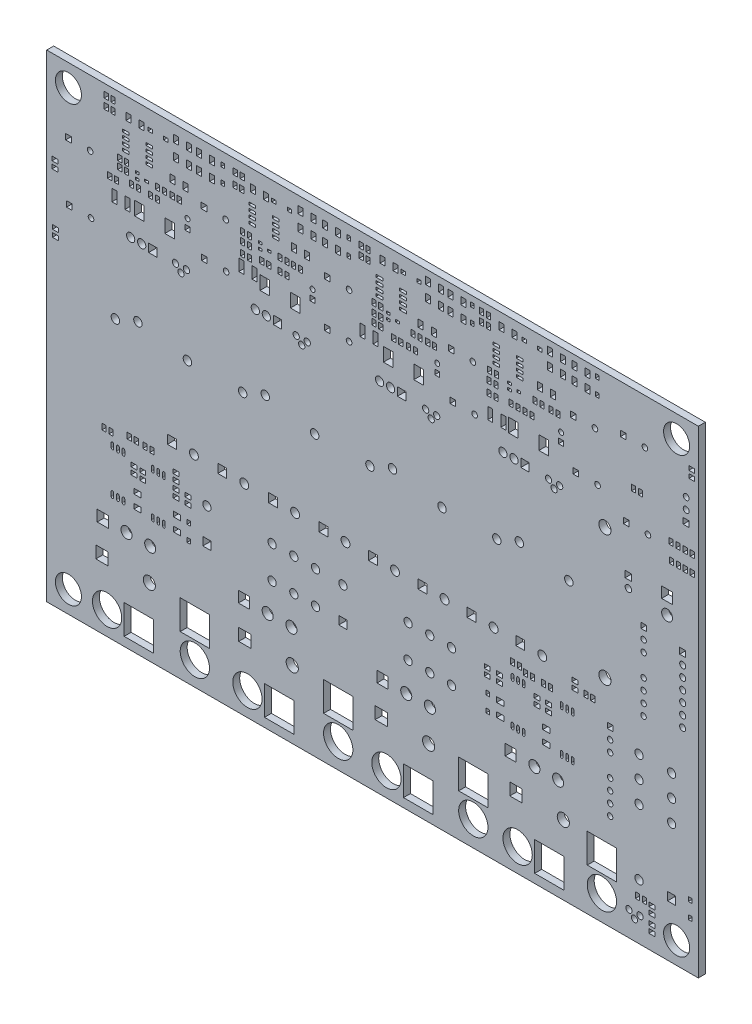
from build123d import *

# Parameters (mm, degrees)
MODEL_W            = 150
MODEL_H            = 110
MODEL_R            = 0.675
MODEL_R_2          = 0.75
MODEL_R_3          = 0.7
MODEL_R_4          = 1.25
MODEL_R_5          = 0.625
MODEL_R_6          = 1.4
MODEL_R_7          = 1.275
MODEL_R_8          = 3.375
MODEL_R_9          = 0.65
MODEL_R_10         = 0.725
MODEL_R_11         = 0.575
MODEL_R_12         = 0.95
MODEL_R_13         = 1.025
MODEL_R_14         = 0.975
MODEL_R_15         = 3
MODEL_W_2          = 2.2
MODEL_H_2          = 3.15
MODEL_W_3          = 1.55
MODEL_H_3          = 0.6
MODEL_W_4          = 1.35
MODEL_H_4          = 1.35
MODEL_W_5          = 0.95
MODEL_W_6          = 1.5
MODEL_H_5          = 1.5
MODEL_W_7          = 1.4
MODEL_H_6          = 1.4
MODEL_W_8          = 2.5
MODEL_H_7          = 2.5
MODEL_W_9          = 1.25
MODEL_H_8          = 1.25
MODEL_W_10         = 2.8
MODEL_H_9          = 2.8
MODEL_W_11         = 2.55
MODEL_H_10         = 2.55
MODEL_W_12         = 6.75
MODEL_H_11         = 6.75
MODEL_W_13         = 1.3
MODEL_H_12         = 1.3
MODEL_W_14         = 1.65
MODEL_H_13         = 1.15
MODEL_W_15         = 1.15
MODEL_H_14         = 1.65
MODEL_H_15         = 2.7
MODEL_H_16         = 0.95
MODEL_W_16         = 0.85
MODEL_H_17         = 0.55
MODEL_W_17         = 0.8
MODEL_H_18         = 1
MODEL_W_18         = 1
MODEL_H_19         = 0.8
MODEL_W_19         = 1.9
MODEL_H_20         = 1.9
MODEL_W_20         = 2.05
MODEL_H_21         = 2.05
BOSS_EXTRU_1_DEPTH = 1.6


with BuildPart() as part:
    # Model → Boss.-Extru.1 (new body)
    with BuildSketch(Plane.XY):
        with Locations((75, -55)):
            Rectangle(MODEL_W, MODEL_H)
        with Locations((147.2, -18.06)):
            Circle(MODEL_R, mode=Mode.SUBTRACT)
        with Locations((147.2, -15.52)):
            Circle(MODEL_R, mode=Mode.SUBTRACT)
        with Locations((133.9, -40.4)):
            Circle(MODEL_R_2, mode=Mode.SUBTRACT)
        with Locations((146.4, -49.4)):
            Circle(MODEL_R_3, mode=Mode.SUBTRACT)
        with Locations((146.4, -51.9)):
            Circle(MODEL_R_3, mode=Mode.SUBTRACT)
        with Locations((146.4, -54.4)):
            Circle(MODEL_R_3, mode=Mode.SUBTRACT)
        with Locations((146.4, -56.9)):
            Circle(MODEL_R_3, mode=Mode.SUBTRACT)
        with Locations((146.4, -59.4)):
            Circle(MODEL_R_3, mode=Mode.SUBTRACT)
        with Locations((146.4, -61.9)):
            Circle(MODEL_R_3, mode=Mode.SUBTRACT)
        with Locations((142.8, -41.26)):
            Circle(MODEL_R_4, mode=Mode.SUBTRACT)
        with Locations((129.7, -72.64)):
            Circle(MODEL_R_5, mode=Mode.SUBTRACT)
        with Locations((129.7, -75.18)):
            Circle(MODEL_R_5, mode=Mode.SUBTRACT)
        with Locations((129.7, -80.26)):
            Circle(MODEL_R_5, mode=Mode.SUBTRACT)
        with Locations((129.7, -82.8)):
            Circle(MODEL_R_5, mode=Mode.SUBTRACT)
        with Locations((129.7, -85.34)):
            Circle(MODEL_R_5, mode=Mode.SUBTRACT)
        with Locations((129.7, -87.88)):
            Circle(MODEL_R_5, mode=Mode.SUBTRACT)
        with Locations((137.4, -48.84)):
            Circle(MODEL_R_5, mode=Mode.SUBTRACT)
        with Locations((137.4, -51.38)):
            Circle(MODEL_R_5, mode=Mode.SUBTRACT)
        with Locations((137.4, -56.46)):
            Circle(MODEL_R_5, mode=Mode.SUBTRACT)
        with Locations((137.4, -59)):
            Circle(MODEL_R_5, mode=Mode.SUBTRACT)
        with Locations((137.4, -61.54)):
            Circle(MODEL_R_5, mode=Mode.SUBTRACT)
        with Locations((137.4, -64.08)):
            Circle(MODEL_R_5, mode=Mode.SUBTRACT)
        with Locations((118.92, -94)):
            Circle(MODEL_R_6, mode=Mode.SUBTRACT)
        with Locations((87.92, -94.3)):
            Circle(MODEL_R_6, mode=Mode.SUBTRACT)
        with Locations((23.62, -94.4)):
            Circle(MODEL_R_6, mode=Mode.SUBTRACT)
        with Locations((56.52, -94.4)):
            Circle(MODEL_R_6, mode=Mode.SUBTRACT)
        with Locations((112.26, -86.7)):
            Circle(MODEL_R_7, mode=Mode.SUBTRACT)
        with Locations((117.72, -86.7)):
            Circle(MODEL_R_7, mode=Mode.SUBTRACT)
        with Locations((82.76, -86.9)):
            Circle(MODEL_R_7, mode=Mode.SUBTRACT)
        with Locations((88.22, -86.9)):
            Circle(MODEL_R_7, mode=Mode.SUBTRACT)
        with Locations((50.86, -86.9)):
            Circle(MODEL_R_7, mode=Mode.SUBTRACT)
        with Locations((56.32, -86.9)):
            Circle(MODEL_R_7, mode=Mode.SUBTRACT)
        with Locations((18.36, -87)):
            Circle(MODEL_R_7, mode=Mode.SUBTRACT)
        with Locations((23.82, -87)):
            Circle(MODEL_R_7, mode=Mode.SUBTRACT)
        with Locations((127.8, -104.2)):
            Circle(MODEL_R_8, mode=Mode.SUBTRACT)
        with Locations((108.4, -104.6)):
            Circle(MODEL_R_8, mode=Mode.SUBTRACT)
        with Locations((98.2, -104.2)):
            Circle(MODEL_R_8, mode=Mode.SUBTRACT)
        with Locations((78.2, -104.6)):
            Circle(MODEL_R_8, mode=Mode.SUBTRACT)
        with Locations((46.2, -104.6)):
            Circle(MODEL_R_8, mode=Mode.SUBTRACT)
        with Locations((67.1, -104.3)):
            Circle(MODEL_R_8, mode=Mode.SUBTRACT)
        with Locations((13.9, -104.6)):
            Circle(MODEL_R_8, mode=Mode.SUBTRACT)
        with Locations((34.1, -104.5)):
            Circle(MODEL_R_8, mode=Mode.SUBTRACT)
        with Locations((126.2, -12.3)):
            Circle(MODEL_R_9, mode=Mode.SUBTRACT)
        with Locations((126.8, -23.3)):
            Circle(MODEL_R_9, mode=Mode.SUBTRACT)
        with Locations((98.1, -13.1)):
            Circle(MODEL_R_9, mode=Mode.SUBTRACT)
        with Locations((98.5, -23.4)):
            Circle(MODEL_R_9, mode=Mode.SUBTRACT)
        with Locations((69.6, -13)):
            Circle(MODEL_R_9, mode=Mode.SUBTRACT)
        with Locations((69.6, -23.3)):
            Circle(MODEL_R_9, mode=Mode.SUBTRACT)
        with Locations((41.2, -13.2)):
            Circle(MODEL_R_9, mode=Mode.SUBTRACT)
        with Locations((41.3, -23.5)):
            Circle(MODEL_R_9, mode=Mode.SUBTRACT)
        with Locations((134.03, -104.3)):
            Circle(MODEL_R_10, mode=Mode.SUBTRACT)
        with Locations((135.3, -105.57)):
            Circle(MODEL_R_10, mode=Mode.SUBTRACT)
        with Locations((136.57, -104.3)):
            Circle(MODEL_R_10, mode=Mode.SUBTRACT)
        with Locations((115.53, -27.8)):
            Circle(MODEL_R_10, mode=Mode.SUBTRACT)
        with Locations((116.8, -29.07)):
            Circle(MODEL_R_10, mode=Mode.SUBTRACT)
        with Locations((118.07, -27.8)):
            Circle(MODEL_R_10, mode=Mode.SUBTRACT)
        with Locations((87.23, -28)):
            Circle(MODEL_R_10, mode=Mode.SUBTRACT)
        with Locations((88.5, -29.27)):
            Circle(MODEL_R_10, mode=Mode.SUBTRACT)
        with Locations((89.77, -28)):
            Circle(MODEL_R_10, mode=Mode.SUBTRACT)
        with Locations((57.43, -28.2)):
            Circle(MODEL_R_10, mode=Mode.SUBTRACT)
        with Locations((58.7, -29.47)):
            Circle(MODEL_R_10, mode=Mode.SUBTRACT)
        with Locations((59.97, -28.2)):
            Circle(MODEL_R_10, mode=Mode.SUBTRACT)
        with Locations((29.63, -27.7)):
            Circle(MODEL_R_10, mode=Mode.SUBTRACT)
        with Locations((30.9, -28.97)):
            Circle(MODEL_R_10, mode=Mode.SUBTRACT)
        with Locations((32.17, -27.7)):
            Circle(MODEL_R_10, mode=Mode.SUBTRACT)
        with Locations((138.4, -27.4)):
            Circle(MODEL_R_9, mode=Mode.SUBTRACT)
        with Locations((137.7, -10.4)):
            Circle(MODEL_R_9, mode=Mode.SUBTRACT)
        with Locations((10.2, -28.4)):
            Circle(MODEL_R_9, mode=Mode.SUBTRACT)
        with Locations((10, -15.1)):
            Circle(MODEL_R_9, mode=Mode.SUBTRACT)
        with Locations((118.4, -17)):
            Circle(MODEL_R_11, mode=Mode.SUBTRACT)
        with Locations((89.9, -17.5)):
            Circle(MODEL_R_11, mode=Mode.SUBTRACT)
        with Locations((61.2, -17.1)):
            Circle(MODEL_R_11, mode=Mode.SUBTRACT)
        with Locations((32.4, -17.4)):
            Circle(MODEL_R_11, mode=Mode.SUBTRACT)
        with Locations((143.85, -82.22)):
            Circle(MODEL_R_12, mode=Mode.SUBTRACT)
        with Locations((143.85, -77.22)):
            Circle(MODEL_R_12, mode=Mode.SUBTRACT)
        with Locations((143.85, -72.22)):
            Circle(MODEL_R_12, mode=Mode.SUBTRACT)
        with Locations((136.35, -72.22)):
            Circle(MODEL_R_12, mode=Mode.SUBTRACT)
        with Locations((136.35, -77.22)):
            Circle(MODEL_R_12, mode=Mode.SUBTRACT)
        with Locations((136.35, -82.22)):
            Circle(MODEL_R_12, mode=Mode.SUBTRACT)
        with Locations((136.35, -97.22)):
            Circle(MODEL_R_12, mode=Mode.SUBTRACT)
        with Locations((83.18, -80.05)):
            Circle(MODEL_R_12, mode=Mode.SUBTRACT)
        with Locations((88.18, -80.05)):
            Circle(MODEL_R_12, mode=Mode.SUBTRACT)
        with Locations((93.18, -80.05)):
            Circle(MODEL_R_12, mode=Mode.SUBTRACT)
        with Locations((93.18, -72.55)):
            Circle(MODEL_R_12, mode=Mode.SUBTRACT)
        with Locations((88.18, -72.55)):
            Circle(MODEL_R_12, mode=Mode.SUBTRACT)
        with Locations((83.18, -72.55)):
            Circle(MODEL_R_12, mode=Mode.SUBTRACT)
        with Locations((68.18, -72.55)):
            Circle(MODEL_R_12, mode=Mode.SUBTRACT)
        with Locations((51.88, -79.95)):
            Circle(MODEL_R_12, mode=Mode.SUBTRACT)
        with Locations((56.88, -79.95)):
            Circle(MODEL_R_12, mode=Mode.SUBTRACT)
        with Locations((61.88, -79.95)):
            Circle(MODEL_R_12, mode=Mode.SUBTRACT)
        with Locations((61.88, -72.45)):
            Circle(MODEL_R_12, mode=Mode.SUBTRACT)
        with Locations((56.88, -72.45)):
            Circle(MODEL_R_12, mode=Mode.SUBTRACT)
        with Locations((51.88, -72.45)):
            Circle(MODEL_R_12, mode=Mode.SUBTRACT)
        with Locations((36.88, -72.45)):
            Circle(MODEL_R_12, mode=Mode.SUBTRACT)
        with Locations((114.08, -63.7)):
            Circle(MODEL_R_13, mode=Mode.SUBTRACT)
        with Locations((91.58, -63.7)):
            Circle(MODEL_R_13, mode=Mode.SUBTRACT)
        with Locations((102.88, -63.7)):
            Circle(MODEL_R_13, mode=Mode.SUBTRACT)
        with Locations((80.18, -63.7)):
            Circle(MODEL_R_13, mode=Mode.SUBTRACT)
        with Locations((68.78, -63.7)):
            Circle(MODEL_R_13, mode=Mode.SUBTRACT)
        with Locations((57.18, -63.7)):
            Circle(MODEL_R_13, mode=Mode.SUBTRACT)
        with Locations((45.48, -63.7)):
            Circle(MODEL_R_13, mode=Mode.SUBTRACT)
        with Locations((33.88, -63.7)):
            Circle(MODEL_R_13, mode=Mode.SUBTRACT)
        with Locations((21.86, -27.7)):
            Circle(MODEL_R_12, mode=Mode.SUBTRACT)
        with Locations((19.32, -27.7)):
            Circle(MODEL_R_12, mode=Mode.SUBTRACT)
        with Locations((50.56, -27.7)):
            Circle(MODEL_R_12, mode=Mode.SUBTRACT)
        with Locations((48.02, -27.7)):
            Circle(MODEL_R_12, mode=Mode.SUBTRACT)
        with Locations((79.16, -27.7)):
            Circle(MODEL_R_12, mode=Mode.SUBTRACT)
        with Locations((76.62, -27.7)):
            Circle(MODEL_R_12, mode=Mode.SUBTRACT)
        with Locations((107.56, -27.7)):
            Circle(MODEL_R_12, mode=Mode.SUBTRACT)
        with Locations((105.02, -27.7)):
            Circle(MODEL_R_12, mode=Mode.SUBTRACT)
        with Locations((103.606, -45.7)):
            Circle(MODEL_R_14, mode=Mode.SUBTRACT)
        with Locations((120.19, -45.7)):
            Circle(MODEL_R_14, mode=Mode.SUBTRACT)
        with Locations((108.8, -43.681)):
            Circle(MODEL_R_14, mode=Mode.SUBTRACT)
        with Locations((74.406, -45.7)):
            Circle(MODEL_R_14, mode=Mode.SUBTRACT)
        with Locations((90.99, -45.7)):
            Circle(MODEL_R_14, mode=Mode.SUBTRACT)
        with Locations((79.6, -43.681)):
            Circle(MODEL_R_14, mode=Mode.SUBTRACT)
        with Locations((45.106, -45.7)):
            Circle(MODEL_R_14, mode=Mode.SUBTRACT)
        with Locations((61.69, -45.7)):
            Circle(MODEL_R_14, mode=Mode.SUBTRACT)
        with Locations((50.3, -43.681)):
            Circle(MODEL_R_14, mode=Mode.SUBTRACT)
        with Locations((15.806, -45.7)):
            Circle(MODEL_R_14, mode=Mode.SUBTRACT)
        with Locations((32.39, -45.7)):
            Circle(MODEL_R_14, mode=Mode.SUBTRACT)
        with Locations((21, -43.681)):
            Circle(MODEL_R_14, mode=Mode.SUBTRACT)
        with Locations((128.5, -60.9)):
            Circle(MODEL_R_6, mode=Mode.SUBTRACT)
        with Locations((128.5, -30.9)):
            Circle(MODEL_R_6, mode=Mode.SUBTRACT)
        with Locations((5, -5)):
            Circle(MODEL_R_15, mode=Mode.SUBTRACT)
        with Locations((145, -5)):
            Circle(MODEL_R_15, mode=Mode.SUBTRACT)
        with Locations((145, -105)):
            Circle(MODEL_R_15, mode=Mode.SUBTRACT)
        with Locations((5, -105)):
            Circle(MODEL_R_15, mode=Mode.SUBTRACT)
        with Locations((114.4, -21.6)):
            Rectangle(MODEL_W_2, MODEL_H_2, mode=Mode.SUBTRACT)
        with Locations((107.4, -21.6)):
            Rectangle(MODEL_W_2, MODEL_H_2, mode=Mode.SUBTRACT)
        with Locations((85.6, -21.9)):
            Rectangle(MODEL_W_2, MODEL_H_2, mode=Mode.SUBTRACT)
        with Locations((78.6, -21.9)):
            Rectangle(MODEL_W_2, MODEL_H_2, mode=Mode.SUBTRACT)
        with Locations((57.2, -21.8)):
            Rectangle(MODEL_W_2, MODEL_H_2, mode=Mode.SUBTRACT)
        with Locations((50.2, -21.8)):
            Rectangle(MODEL_W_2, MODEL_H_2, mode=Mode.SUBTRACT)
        with Locations((28.3, -21.4)):
            Rectangle(MODEL_W_2, MODEL_H_2, mode=Mode.SUBTRACT)
        with Locations((21.3, -21.4)):
            Rectangle(MODEL_W_2, MODEL_H_2, mode=Mode.SUBTRACT)
        with Locations((18.2, -7.295)):
            Rectangle(MODEL_W_3, MODEL_H_3, mode=Mode.SUBTRACT)
        with Locations((18.2, -8.565)):
            Rectangle(MODEL_W_3, MODEL_H_3, mode=Mode.SUBTRACT)
        with Locations((18.2, -9.835)):
            Rectangle(MODEL_W_3, MODEL_H_3, mode=Mode.SUBTRACT)
        with Locations((18.2, -11.105)):
            Rectangle(MODEL_W_3, MODEL_H_3, mode=Mode.SUBTRACT)
        with Locations((23.6, -11.105)):
            Rectangle(MODEL_W_3, MODEL_H_3, mode=Mode.SUBTRACT)
        with Locations((23.6, -9.835)):
            Rectangle(MODEL_W_3, MODEL_H_3, mode=Mode.SUBTRACT)
        with Locations((23.6, -8.565)):
            Rectangle(MODEL_W_3, MODEL_H_3, mode=Mode.SUBTRACT)
        with Locations((23.6, -7.295)):
            Rectangle(MODEL_W_3, MODEL_H_3, mode=Mode.SUBTRACT)
        with Locations((103.5, -7.095)):
            Rectangle(MODEL_W_3, MODEL_H_3, mode=Mode.SUBTRACT)
        with Locations((103.5, -8.365)):
            Rectangle(MODEL_W_3, MODEL_H_3, mode=Mode.SUBTRACT)
        with Locations((103.5, -9.635)):
            Rectangle(MODEL_W_3, MODEL_H_3, mode=Mode.SUBTRACT)
        with Locations((103.5, -10.905)):
            Rectangle(MODEL_W_3, MODEL_H_3, mode=Mode.SUBTRACT)
        with Locations((108.9, -10.905)):
            Rectangle(MODEL_W_3, MODEL_H_3, mode=Mode.SUBTRACT)
        with Locations((108.9, -9.635)):
            Rectangle(MODEL_W_3, MODEL_H_3, mode=Mode.SUBTRACT)
        with Locations((108.9, -8.365)):
            Rectangle(MODEL_W_3, MODEL_H_3, mode=Mode.SUBTRACT)
        with Locations((108.9, -7.095)):
            Rectangle(MODEL_W_3, MODEL_H_3, mode=Mode.SUBTRACT)
        with Locations((76.6, -7.095)):
            Rectangle(MODEL_W_3, MODEL_H_3, mode=Mode.SUBTRACT)
        with Locations((76.6, -8.365)):
            Rectangle(MODEL_W_3, MODEL_H_3, mode=Mode.SUBTRACT)
        with Locations((76.6, -9.635)):
            Rectangle(MODEL_W_3, MODEL_H_3, mode=Mode.SUBTRACT)
        with Locations((76.6, -10.905)):
            Rectangle(MODEL_W_3, MODEL_H_3, mode=Mode.SUBTRACT)
        with Locations((82, -10.905)):
            Rectangle(MODEL_W_3, MODEL_H_3, mode=Mode.SUBTRACT)
        with Locations((82, -9.635)):
            Rectangle(MODEL_W_3, MODEL_H_3, mode=Mode.SUBTRACT)
        with Locations((82, -8.365)):
            Rectangle(MODEL_W_3, MODEL_H_3, mode=Mode.SUBTRACT)
        with Locations((82, -7.095)):
            Rectangle(MODEL_W_3, MODEL_H_3, mode=Mode.SUBTRACT)
        with Locations((47.3, -7.295)):
            Rectangle(MODEL_W_3, MODEL_H_3, mode=Mode.SUBTRACT)
        with Locations((47.3, -8.565)):
            Rectangle(MODEL_W_3, MODEL_H_3, mode=Mode.SUBTRACT)
        with Locations((47.3, -9.835)):
            Rectangle(MODEL_W_3, MODEL_H_3, mode=Mode.SUBTRACT)
        with Locations((47.3, -11.105)):
            Rectangle(MODEL_W_3, MODEL_H_3, mode=Mode.SUBTRACT)
        with Locations((52.7, -11.105)):
            Rectangle(MODEL_W_3, MODEL_H_3, mode=Mode.SUBTRACT)
        with Locations((52.7, -9.835)):
            Rectangle(MODEL_W_3, MODEL_H_3, mode=Mode.SUBTRACT)
        with Locations((52.7, -8.565)):
            Rectangle(MODEL_W_3, MODEL_H_3, mode=Mode.SUBTRACT)
        with Locations((52.7, -7.295)):
            Rectangle(MODEL_W_3, MODEL_H_3, mode=Mode.SUBTRACT)
        with Locations((147.2, -20.6)):
            Rectangle(MODEL_W_4, MODEL_H_4, mode=Mode.SUBTRACT)
        with Locations((145.4, -30)):
            Rectangle(MODEL_W_5, MODEL_H_4, mode=Mode.SUBTRACT)
        with Locations((143.8, -30)):
            Rectangle(MODEL_W_5, MODEL_H_4, mode=Mode.SUBTRACT)
        with Locations((145.3, -26.2)):
            Rectangle(MODEL_W_5, MODEL_H_4, mode=Mode.SUBTRACT)
        with Locations((143.7, -26.2)):
            Rectangle(MODEL_W_5, MODEL_H_4, mode=Mode.SUBTRACT)
        with Locations((133.9, -37.9)):
            Rectangle(MODEL_W_6, MODEL_H_5, mode=Mode.SUBTRACT)
        with Locations((146.4, -46.9)):
            Rectangle(MODEL_W_7, MODEL_H_6, mode=Mode.SUBTRACT)
        with Locations((142.8, -37.3)):
            Rectangle(MODEL_W_8, MODEL_H_7, mode=Mode.SUBTRACT)
        with Locations((129.7, -70.1)):
            Rectangle(MODEL_W_9, MODEL_H_8, mode=Mode.SUBTRACT)
        with Locations((137.4, -46.3)):
            Rectangle(MODEL_W_9, MODEL_H_8, mode=Mode.SUBTRACT)
        with BuildLine():
            Line((120.77, -71.925), (120.77, -70.975))
            ThreePointArc((120.77, -70.975), (121.07, -70.675), (121.37, -70.975))
            Line((121.37, -70.975), (121.37, -71.925))
            ThreePointArc((121.37, -71.925), (121.07, -72.225), (120.77, -71.925))
        make_face(mode=Mode.SUBTRACT)
        with BuildLine():
            Line((119.5, -71.925), (119.5, -70.975))
            ThreePointArc((119.5, -70.975), (119.8, -70.675), (120.1, -70.975))
            Line((120.1, -70.975), (120.1, -71.925))
            ThreePointArc((120.1, -71.925), (119.8, -72.225), (119.5, -71.925))
        make_face(mode=Mode.SUBTRACT)
        with BuildLine():
            Line((118.23, -71.925), (118.23, -70.975))
            ThreePointArc((118.23, -70.975), (118.53, -70.675), (118.83, -70.975))
            Line((118.83, -70.975), (118.83, -71.925))
            ThreePointArc((118.83, -71.925), (118.53, -72.225), (118.23, -71.925))
        make_face(mode=Mode.SUBTRACT)
        with BuildLine():
            Line((118.23, -81.625), (118.23, -80.675))
            ThreePointArc((118.23, -80.675), (118.53, -80.375), (118.83, -80.675))
            Line((118.83, -80.675), (118.83, -81.625))
            ThreePointArc((118.83, -81.625), (118.53, -81.925), (118.23, -81.625))
        make_face(mode=Mode.SUBTRACT)
        with BuildLine():
            Line((119.5, -81.625), (119.5, -80.675))
            ThreePointArc((119.5, -80.675), (119.8, -80.375), (120.1, -80.675))
            Line((120.1, -80.675), (120.1, -81.625))
            ThreePointArc((120.1, -81.625), (119.8, -81.925), (119.5, -81.625))
        make_face(mode=Mode.SUBTRACT)
        with BuildLine():
            Line((120.77, -81.625), (120.77, -80.675))
            ThreePointArc((120.77, -80.675), (121.07, -80.375), (121.37, -80.675))
            Line((121.37, -80.675), (121.37, -81.625))
            ThreePointArc((121.37, -81.625), (121.07, -81.925), (120.77, -81.625))
        make_face(mode=Mode.SUBTRACT)
        with BuildLine():
            Line((109.47, -71.925), (109.47, -70.975))
            ThreePointArc((109.47, -70.975), (109.77, -70.675), (110.07, -70.975))
            Line((110.07, -70.975), (110.07, -71.925))
            ThreePointArc((110.07, -71.925), (109.77, -72.225), (109.47, -71.925))
        make_face(mode=Mode.SUBTRACT)
        with BuildLine():
            Line((108.2, -71.925), (108.2, -70.975))
            ThreePointArc((108.2, -70.975), (108.5, -70.675), (108.8, -70.975))
            Line((108.8, -70.975), (108.8, -71.925))
            ThreePointArc((108.8, -71.925), (108.5, -72.225), (108.2, -71.925))
        make_face(mode=Mode.SUBTRACT)
        with BuildLine():
            Line((106.93, -71.925), (106.93, -70.975))
            ThreePointArc((106.93, -70.975), (107.23, -70.675), (107.53, -70.975))
            Line((107.53, -70.975), (107.53, -71.925))
            ThreePointArc((107.53, -71.925), (107.23, -72.225), (106.93, -71.925))
        make_face(mode=Mode.SUBTRACT)
        with BuildLine():
            Line((106.93, -81.625), (106.93, -80.675))
            ThreePointArc((106.93, -80.675), (107.23, -80.375), (107.53, -80.675))
            Line((107.53, -80.675), (107.53, -81.625))
            ThreePointArc((107.53, -81.625), (107.23, -81.925), (106.93, -81.625))
        make_face(mode=Mode.SUBTRACT)
        with BuildLine():
            Line((108.2, -81.625), (108.2, -80.675))
            ThreePointArc((108.2, -80.675), (108.5, -80.375), (108.8, -80.675))
            Line((108.8, -80.675), (108.8, -81.625))
            ThreePointArc((108.8, -81.625), (108.5, -81.925), (108.2, -81.625))
        make_face(mode=Mode.SUBTRACT)
        with BuildLine():
            Line((109.47, -81.625), (109.47, -80.675))
            ThreePointArc((109.47, -80.675), (109.77, -80.375), (110.07, -80.675))
            Line((110.07, -80.675), (110.07, -81.625))
            ThreePointArc((110.07, -81.625), (109.77, -81.925), (109.47, -81.625))
        make_face(mode=Mode.SUBTRACT)
        with BuildLine():
            Line((26.67, -71.825), (26.67, -70.875))
            ThreePointArc((26.67, -70.875), (26.97, -70.575), (27.27, -70.875))
            Line((27.27, -70.875), (27.27, -71.825))
            ThreePointArc((27.27, -71.825), (26.97, -72.125), (26.67, -71.825))
        make_face(mode=Mode.SUBTRACT)
        with BuildLine():
            Line((25.4, -71.825), (25.4, -70.875))
            ThreePointArc((25.4, -70.875), (25.7, -70.575), (26, -70.875))
            Line((26, -70.875), (26, -71.825))
            ThreePointArc((26, -71.825), (25.7, -72.125), (25.4, -71.825))
        make_face(mode=Mode.SUBTRACT)
        with BuildLine():
            Line((24.13, -71.825), (24.13, -70.875))
            ThreePointArc((24.13, -70.875), (24.43, -70.575), (24.73, -70.875))
            Line((24.73, -70.875), (24.73, -71.825))
            ThreePointArc((24.73, -71.825), (24.43, -72.125), (24.13, -71.825))
        make_face(mode=Mode.SUBTRACT)
        with BuildLine():
            Line((24.13, -81.525), (24.13, -80.575))
            ThreePointArc((24.13, -80.575), (24.43, -80.275), (24.73, -80.575))
            Line((24.73, -80.575), (24.73, -81.525))
            ThreePointArc((24.73, -81.525), (24.43, -81.825), (24.13, -81.525))
        make_face(mode=Mode.SUBTRACT)
        with BuildLine():
            Line((25.4, -81.525), (25.4, -80.575))
            ThreePointArc((25.4, -80.575), (25.7, -80.275), (26, -80.575))
            Line((26, -80.575), (26, -81.525))
            ThreePointArc((26, -81.525), (25.7, -81.825), (25.4, -81.525))
        make_face(mode=Mode.SUBTRACT)
        with BuildLine():
            Line((26.67, -81.525), (26.67, -80.575))
            ThreePointArc((26.67, -80.575), (26.97, -80.275), (27.27, -80.575))
            Line((27.27, -80.575), (27.27, -81.525))
            ThreePointArc((27.27, -81.525), (26.97, -81.825), (26.67, -81.525))
        make_face(mode=Mode.SUBTRACT)
        with BuildLine():
            Line((17.37, -71.825), (17.37, -70.875))
            ThreePointArc((17.37, -70.875), (17.67, -70.575), (17.97, -70.875))
            Line((17.97, -70.875), (17.97, -71.825))
            ThreePointArc((17.97, -71.825), (17.67, -72.125), (17.37, -71.825))
        make_face(mode=Mode.SUBTRACT)
        with BuildLine():
            Line((16.1, -71.825), (16.1, -70.875))
            ThreePointArc((16.1, -70.875), (16.4, -70.575), (16.7, -70.875))
            Line((16.7, -70.875), (16.7, -71.825))
            ThreePointArc((16.7, -71.825), (16.4, -72.125), (16.1, -71.825))
        make_face(mode=Mode.SUBTRACT)
        with BuildLine():
            Line((14.83, -71.825), (14.83, -70.875))
            ThreePointArc((14.83, -70.875), (15.13, -70.575), (15.43, -70.875))
            Line((15.43, -70.875), (15.43, -71.825))
            ThreePointArc((15.43, -71.825), (15.13, -72.125), (14.83, -71.825))
        make_face(mode=Mode.SUBTRACT)
        with BuildLine():
            Line((14.83, -81.525), (14.83, -80.575))
            ThreePointArc((14.83, -80.575), (15.13, -80.275), (15.43, -80.575))
            Line((15.43, -80.575), (15.43, -81.525))
            ThreePointArc((15.43, -81.525), (15.13, -81.825), (14.83, -81.525))
        make_face(mode=Mode.SUBTRACT)
        with BuildLine():
            Line((16.1, -81.525), (16.1, -80.575))
            ThreePointArc((16.1, -80.575), (16.4, -80.275), (16.7, -80.575))
            Line((16.7, -80.575), (16.7, -81.525))
            ThreePointArc((16.7, -81.525), (16.4, -81.825), (16.1, -81.525))
        make_face(mode=Mode.SUBTRACT)
        with BuildLine():
            Line((17.37, -81.525), (17.37, -80.575))
            ThreePointArc((17.37, -80.575), (17.67, -80.275), (17.97, -80.575))
            Line((17.97, -80.575), (17.97, -81.525))
            ThreePointArc((17.97, -81.525), (17.67, -81.825), (17.37, -81.525))
        make_face(mode=Mode.SUBTRACT)
        with Locations((108, -94)):
            Rectangle(MODEL_W_10, MODEL_H_9, mode=Mode.SUBTRACT)
        with Locations((77, -94.3)):
            Rectangle(MODEL_W_10, MODEL_H_9, mode=Mode.SUBTRACT)
        with Locations((12.7, -94.4)):
            Rectangle(MODEL_W_10, MODEL_H_9, mode=Mode.SUBTRACT)
        with Locations((45.6, -94.4)):
            Rectangle(MODEL_W_10, MODEL_H_9, mode=Mode.SUBTRACT)
        with Locations((106.8, -86.7)):
            Rectangle(MODEL_W_11, MODEL_H_10, mode=Mode.SUBTRACT)
        with Locations((77.3, -86.9)):
            Rectangle(MODEL_W_11, MODEL_H_10, mode=Mode.SUBTRACT)
        with Locations((45.4, -86.9)):
            Rectangle(MODEL_W_11, MODEL_H_10, mode=Mode.SUBTRACT)
        with Locations((12.9, -87)):
            Rectangle(MODEL_W_11, MODEL_H_10, mode=Mode.SUBTRACT)
        with Locations((127.8, -96.9)):
            Rectangle(MODEL_W_12, MODEL_H_11, mode=Mode.SUBTRACT)
        with Locations((115.7, -104.6)):
            Rectangle(MODEL_W_12, MODEL_H_11, mode=Mode.SUBTRACT)
        with Locations((98.2, -96.9)):
            Rectangle(MODEL_W_12, MODEL_H_11, mode=Mode.SUBTRACT)
        with Locations((85.5, -104.6)):
            Rectangle(MODEL_W_12, MODEL_H_11, mode=Mode.SUBTRACT)
        with Locations((53.5, -104.6)):
            Rectangle(MODEL_W_12, MODEL_H_11, mode=Mode.SUBTRACT)
        with Locations((67.1, -97)):
            Rectangle(MODEL_W_12, MODEL_H_11, mode=Mode.SUBTRACT)
        with Locations((21.2, -104.6)):
            Rectangle(MODEL_W_12, MODEL_H_11, mode=Mode.SUBTRACT)
        with Locations((34.1, -97.2)):
            Rectangle(MODEL_W_12, MODEL_H_11, mode=Mode.SUBTRACT)
        with Locations((121.2, -12.3)):
            Rectangle(MODEL_W_13, MODEL_H_12, mode=Mode.SUBTRACT)
        with Locations((121.8, -23.3)):
            Rectangle(MODEL_W_13, MODEL_H_12, mode=Mode.SUBTRACT)
        with Locations((93.1, -13.1)):
            Rectangle(MODEL_W_13, MODEL_H_12, mode=Mode.SUBTRACT)
        with Locations((93.5, -23.4)):
            Rectangle(MODEL_W_13, MODEL_H_12, mode=Mode.SUBTRACT)
        with Locations((64.6, -13)):
            Rectangle(MODEL_W_13, MODEL_H_12, mode=Mode.SUBTRACT)
        with Locations((64.6, -23.3)):
            Rectangle(MODEL_W_13, MODEL_H_12, mode=Mode.SUBTRACT)
        with Locations((36.2, -13.2)):
            Rectangle(MODEL_W_13, MODEL_H_12, mode=Mode.SUBTRACT)
        with Locations((36.3, -23.5)):
            Rectangle(MODEL_W_13, MODEL_H_12, mode=Mode.SUBTRACT)
        with Locations((115, -80.8)):
            Rectangle(MODEL_W_14, MODEL_H_13, mode=Mode.SUBTRACT)
        with Locations((115, -77.8)):
            Rectangle(MODEL_W_14, MODEL_H_13, mode=Mode.SUBTRACT)
        with Locations((104.4, -80.7)):
            Rectangle(MODEL_W_14, MODEL_H_13, mode=Mode.SUBTRACT)
        with Locations((104.4, -77.7)):
            Rectangle(MODEL_W_14, MODEL_H_13, mode=Mode.SUBTRACT)
        with Locations((30, -80.9)):
            Rectangle(MODEL_W_14, MODEL_H_13, mode=Mode.SUBTRACT)
        with Locations((30, -77.9)):
            Rectangle(MODEL_W_14, MODEL_H_13, mode=Mode.SUBTRACT)
        with Locations((20.9, -80.9)):
            Rectangle(MODEL_W_14, MODEL_H_13, mode=Mode.SUBTRACT)
        with Locations((20.9, -77.9)):
            Rectangle(MODEL_W_14, MODEL_H_13, mode=Mode.SUBTRACT)
        with Locations((104.7, -2.9)):
            Rectangle(MODEL_W_15, MODEL_H_14, mode=Mode.SUBTRACT)
        with Locations((107.7, -2.9)):
            Rectangle(MODEL_W_15, MODEL_H_14, mode=Mode.SUBTRACT)
        with Locations((77.3, -3.3)):
            Rectangle(MODEL_W_15, MODEL_H_14, mode=Mode.SUBTRACT)
        with Locations((80.3, -3.3)):
            Rectangle(MODEL_W_15, MODEL_H_14, mode=Mode.SUBTRACT)
        with Locations((116.5, -10.4)):
            Rectangle(MODEL_W_15, MODEL_H_14, mode=Mode.SUBTRACT)
        with Locations((113.5, -10.4)):
            Rectangle(MODEL_W_15, MODEL_H_14, mode=Mode.SUBTRACT)
        with Locations((89.1, -11.7)):
            Rectangle(MODEL_W_15, MODEL_H_14, mode=Mode.SUBTRACT)
        with Locations((86.1, -11.7)):
            Rectangle(MODEL_W_15, MODEL_H_14, mode=Mode.SUBTRACT)
        with Locations((118.8, -2.2)):
            Rectangle(MODEL_W_15, MODEL_H_14, mode=Mode.SUBTRACT)
        with Locations((115.8, -2.2)):
            Rectangle(MODEL_W_15, MODEL_H_14, mode=Mode.SUBTRACT)
        with Locations((124.5, -2.2)):
            Rectangle(MODEL_W_15, MODEL_H_14, mode=Mode.SUBTRACT)
        with Locations((121.5, -2.2)):
            Rectangle(MODEL_W_15, MODEL_H_14, mode=Mode.SUBTRACT)
        with Locations((115.8, -5.3)):
            Rectangle(MODEL_W_15, MODEL_H_14, mode=Mode.SUBTRACT)
        with Locations((118.8, -5.3)):
            Rectangle(MODEL_W_15, MODEL_H_14, mode=Mode.SUBTRACT)
        with Locations((121.5, -5.3)):
            Rectangle(MODEL_W_15, MODEL_H_14, mode=Mode.SUBTRACT)
        with Locations((124.5, -5.3)):
            Rectangle(MODEL_W_15, MODEL_H_14, mode=Mode.SUBTRACT)
        with Locations((90.8, -2.3)):
            Rectangle(MODEL_W_15, MODEL_H_14, mode=Mode.SUBTRACT)
        with Locations((87.8, -2.3)):
            Rectangle(MODEL_W_15, MODEL_H_14, mode=Mode.SUBTRACT)
        with Locations((95.9, -2.3)):
            Rectangle(MODEL_W_15, MODEL_H_14, mode=Mode.SUBTRACT)
        with Locations((92.9, -2.3)):
            Rectangle(MODEL_W_15, MODEL_H_14, mode=Mode.SUBTRACT)
        with Locations((92.9, -5.7)):
            Rectangle(MODEL_W_15, MODEL_H_14, mode=Mode.SUBTRACT)
        with Locations((95.9, -5.7)):
            Rectangle(MODEL_W_15, MODEL_H_14, mode=Mode.SUBTRACT)
        with Locations((87.8, -5.7)):
            Rectangle(MODEL_W_15, MODEL_H_14, mode=Mode.SUBTRACT)
        with Locations((90.8, -5.7)):
            Rectangle(MODEL_W_15, MODEL_H_14, mode=Mode.SUBTRACT)
        with Locations((47.5, -4)):
            Rectangle(MODEL_W_15, MODEL_H_14, mode=Mode.SUBTRACT)
        with Locations((50.5, -4)):
            Rectangle(MODEL_W_15, MODEL_H_14, mode=Mode.SUBTRACT)
        with Locations((61.4, -2.9)):
            Rectangle(MODEL_W_15, MODEL_H_14, mode=Mode.SUBTRACT)
        with Locations((58.4, -2.9)):
            Rectangle(MODEL_W_15, MODEL_H_14, mode=Mode.SUBTRACT)
        with Locations((67.1, -2.9)):
            Rectangle(MODEL_W_15, MODEL_H_14, mode=Mode.SUBTRACT)
        with Locations((64.1, -2.9)):
            Rectangle(MODEL_W_15, MODEL_H_14, mode=Mode.SUBTRACT)
        with Locations((58.4, -6.4)):
            Rectangle(MODEL_W_15, MODEL_H_14, mode=Mode.SUBTRACT)
        with Locations((61.4, -6.4)):
            Rectangle(MODEL_W_15, MODEL_H_14, mode=Mode.SUBTRACT)
        with Locations((64.1, -6.4)):
            Rectangle(MODEL_W_15, MODEL_H_14, mode=Mode.SUBTRACT)
        with Locations((67.1, -6.4)):
            Rectangle(MODEL_W_15, MODEL_H_14, mode=Mode.SUBTRACT)
        with Locations((59.9, -11)):
            Rectangle(MODEL_W_15, MODEL_H_14, mode=Mode.SUBTRACT)
        with Locations((56.9, -11)):
            Rectangle(MODEL_W_15, MODEL_H_14, mode=Mode.SUBTRACT)
        with Locations((32.8, -3)):
            Rectangle(MODEL_W_15, MODEL_H_14, mode=Mode.SUBTRACT)
        with Locations((29.8, -3)):
            Rectangle(MODEL_W_15, MODEL_H_14, mode=Mode.SUBTRACT)
        with Locations((38.1, -3)):
            Rectangle(MODEL_W_15, MODEL_H_14, mode=Mode.SUBTRACT)
        with Locations((35.1, -3)):
            Rectangle(MODEL_W_15, MODEL_H_14, mode=Mode.SUBTRACT)
        with Locations((35.1, -6.6)):
            Rectangle(MODEL_W_15, MODEL_H_14, mode=Mode.SUBTRACT)
        with Locations((38.1, -6.6)):
            Rectangle(MODEL_W_15, MODEL_H_14, mode=Mode.SUBTRACT)
        with Locations((29.8, -6.6)):
            Rectangle(MODEL_W_15, MODEL_H_14, mode=Mode.SUBTRACT)
        with Locations((32.8, -6.6)):
            Rectangle(MODEL_W_15, MODEL_H_14, mode=Mode.SUBTRACT)
        with Locations((31.9, -11.3)):
            Rectangle(MODEL_W_15, MODEL_H_14, mode=Mode.SUBTRACT)
        with Locations((28.9, -11.3)):
            Rectangle(MODEL_W_15, MODEL_H_14, mode=Mode.SUBTRACT)
        with Locations((18.8, -4.1)):
            Rectangle(MODEL_W_15, MODEL_H_14, mode=Mode.SUBTRACT)
        with Locations((21.8, -4.1)):
            Rectangle(MODEL_W_15, MODEL_H_14, mode=Mode.SUBTRACT)
        with Locations((133.4, -27.4)):
            Rectangle(MODEL_W_13, MODEL_H_12, mode=Mode.SUBTRACT)
        with Locations((132.7, -10.4)):
            Rectangle(MODEL_W_13, MODEL_H_12, mode=Mode.SUBTRACT)
        with Locations((5.2, -28.4)):
            Rectangle(MODEL_W_13, MODEL_H_12, mode=Mode.SUBTRACT)
        with Locations((5, -15.1)):
            Rectangle(MODEL_W_13, MODEL_H_12, mode=Mode.SUBTRACT)
        with Locations((118.4, -19)):
            Rectangle(MODEL_W_15, MODEL_H_13, mode=Mode.SUBTRACT)
        with Locations((89.9, -19.5)):
            Rectangle(MODEL_W_15, MODEL_H_13, mode=Mode.SUBTRACT)
        with Locations((61.2, -19.1)):
            Rectangle(MODEL_W_15, MODEL_H_13, mode=Mode.SUBTRACT)
        with Locations((32.4, -19.4)):
            Rectangle(MODEL_W_15, MODEL_H_13, mode=Mode.SUBTRACT)
        with Locations((105.1, -21.6)):
            Rectangle(MODEL_W_15, MODEL_H_15, mode=Mode.SUBTRACT)
        with Locations((102.1, -21.6)):
            Rectangle(MODEL_W_15, MODEL_H_15, mode=Mode.SUBTRACT)
        with Locations((75.7, -19.7)):
            Rectangle(MODEL_W_15, MODEL_H_15, mode=Mode.SUBTRACT)
        with Locations((72.7, -19.7)):
            Rectangle(MODEL_W_15, MODEL_H_15, mode=Mode.SUBTRACT)
        with Locations((47.8, -20.7)):
            Rectangle(MODEL_W_15, MODEL_H_15, mode=Mode.SUBTRACT)
        with Locations((44.8, -20.7)):
            Rectangle(MODEL_W_15, MODEL_H_15, mode=Mode.SUBTRACT)
        with Locations((18.6, -21.4)):
            Rectangle(MODEL_W_15, MODEL_H_15, mode=Mode.SUBTRACT)
        with Locations((15.6, -21.4)):
            Rectangle(MODEL_W_15, MODEL_H_15, mode=Mode.SUBTRACT)
        with Locations((147, -30)):
            Rectangle(MODEL_W_5, MODEL_H_4, mode=Mode.SUBTRACT)
        with Locations((148.6, -30)):
            Rectangle(MODEL_W_5, MODEL_H_4, mode=Mode.SUBTRACT)
        with Locations((136, -100.7)):
            Rectangle(MODEL_W_5, MODEL_H_4, mode=Mode.SUBTRACT)
        with Locations((137.6, -100.7)):
            Rectangle(MODEL_W_5, MODEL_H_4, mode=Mode.SUBTRACT)
        with Locations((114.4, -69.1)):
            Rectangle(MODEL_W_5, MODEL_H_4, mode=Mode.SUBTRACT)
        with Locations((116, -69.1)):
            Rectangle(MODEL_W_5, MODEL_H_4, mode=Mode.SUBTRACT)
        with Locations((107.2, -68.4)):
            Rectangle(MODEL_W_5, MODEL_H_4, mode=Mode.SUBTRACT)
        with Locations((108.8, -68.4)):
            Rectangle(MODEL_W_5, MODEL_H_4, mode=Mode.SUBTRACT)
        with Locations((22.6, -67.7)):
            Rectangle(MODEL_W_5, MODEL_H_4, mode=Mode.SUBTRACT)
        with Locations((24.2, -67.7)):
            Rectangle(MODEL_W_5, MODEL_H_4, mode=Mode.SUBTRACT)
        with Locations((13.2, -68.7)):
            Rectangle(MODEL_W_5, MODEL_H_4, mode=Mode.SUBTRACT)
        with Locations((14.8, -68.7)):
            Rectangle(MODEL_W_5, MODEL_H_4, mode=Mode.SUBTRACT)
        with Locations((124.1, -66.4)):
            Rectangle(MODEL_W_5, MODEL_H_4, mode=Mode.SUBTRACT)
        with Locations((125.7, -66.4)):
            Rectangle(MODEL_W_5, MODEL_H_4, mode=Mode.SUBTRACT)
        with Locations((111.8, -69.1)):
            Rectangle(MODEL_W_5, MODEL_H_4, mode=Mode.SUBTRACT)
        with Locations((110.2, -69.1)):
            Rectangle(MODEL_W_5, MODEL_H_4, mode=Mode.SUBTRACT)
        with Locations((29.8, -71)):
            Rectangle(MODEL_W_4, MODEL_H_16, mode=Mode.SUBTRACT)
        with Locations((29.8, -69.4)):
            Rectangle(MODEL_W_4, MODEL_H_16, mode=Mode.SUBTRACT)
        with Locations((20.6, -67.6)):
            Rectangle(MODEL_W_5, MODEL_H_4, mode=Mode.SUBTRACT)
        with Locations((19, -67.6)):
            Rectangle(MODEL_W_5, MODEL_H_4, mode=Mode.SUBTRACT)
        with Locations((147, -26.2)):
            Rectangle(MODEL_W_5, MODEL_H_4, mode=Mode.SUBTRACT)
        with Locations((148.6, -26.2)):
            Rectangle(MODEL_W_5, MODEL_H_4, mode=Mode.SUBTRACT)
        with Locations((139.3, -106.3)):
            Rectangle(MODEL_W_4, MODEL_H_16, mode=Mode.SUBTRACT)
        with Locations((139.3, -104.7)):
            Rectangle(MODEL_W_4, MODEL_H_16, mode=Mode.SUBTRACT)
        with Locations((139.3, -102.6)):
            Rectangle(MODEL_W_4, MODEL_H_16, mode=Mode.SUBTRACT)
        with Locations((139.3, -101)):
            Rectangle(MODEL_W_4, MODEL_H_16, mode=Mode.SUBTRACT)
        with Locations((121.6, -65)):
            Rectangle(MODEL_W_4, MODEL_H_16, mode=Mode.SUBTRACT)
        with Locations((121.6, -66.6)):
            Rectangle(MODEL_W_4, MODEL_H_16, mode=Mode.SUBTRACT)
        with Locations((115.5, -72.6)):
            Rectangle(MODEL_W_4, MODEL_H_16, mode=Mode.SUBTRACT)
        with Locations((115.5, -74.2)):
            Rectangle(MODEL_W_4, MODEL_H_16, mode=Mode.SUBTRACT)
        with Locations((112.9, -72.6)):
            Rectangle(MODEL_W_4, MODEL_H_16, mode=Mode.SUBTRACT)
        with Locations((112.9, -74.2)):
            Rectangle(MODEL_W_4, MODEL_H_16, mode=Mode.SUBTRACT)
        with Locations((104.2, -72.4)):
            Rectangle(MODEL_W_4, MODEL_H_16, mode=Mode.SUBTRACT)
        with Locations((104.2, -74)):
            Rectangle(MODEL_W_4, MODEL_H_16, mode=Mode.SUBTRACT)
        with Locations((101.4, -72.4)):
            Rectangle(MODEL_W_4, MODEL_H_16, mode=Mode.SUBTRACT)
        with Locations((101.4, -74)):
            Rectangle(MODEL_W_4, MODEL_H_16, mode=Mode.SUBTRACT)
        with Locations((32.5, -72.7)):
            Rectangle(MODEL_W_4, MODEL_H_16, mode=Mode.SUBTRACT)
        with Locations((32.5, -74.3)):
            Rectangle(MODEL_W_4, MODEL_H_16, mode=Mode.SUBTRACT)
        with Locations((29.8, -72.7)):
            Rectangle(MODEL_W_4, MODEL_H_16, mode=Mode.SUBTRACT)
        with Locations((29.8, -74.3)):
            Rectangle(MODEL_W_4, MODEL_H_16, mode=Mode.SUBTRACT)
        with Locations((22.1, -73)):
            Rectangle(MODEL_W_4, MODEL_H_16, mode=Mode.SUBTRACT)
        with Locations((22.1, -74.6)):
            Rectangle(MODEL_W_4, MODEL_H_16, mode=Mode.SUBTRACT)
        with Locations((20.1, -72.9)):
            Rectangle(MODEL_W_4, MODEL_H_16, mode=Mode.SUBTRACT)
        with Locations((20.1, -74.5)):
            Rectangle(MODEL_W_4, MODEL_H_16, mode=Mode.SUBTRACT)
        with Locations((136.7, -19.9)):
            Rectangle(MODEL_W_5, MODEL_H_4, mode=Mode.SUBTRACT)
        with Locations((135.1, -19.9)):
            Rectangle(MODEL_W_5, MODEL_H_4, mode=Mode.SUBTRACT)
        with Locations((148.5, -9.4)):
            Rectangle(MODEL_W_4, MODEL_H_16, mode=Mode.SUBTRACT)
        with Locations((148.5, -11)):
            Rectangle(MODEL_W_4, MODEL_H_16, mode=Mode.SUBTRACT)
        with Locations((76.9, -14.8)):
            Rectangle(MODEL_W_5, MODEL_H_4, mode=Mode.SUBTRACT)
        with Locations((75.3, -14.8)):
            Rectangle(MODEL_W_5, MODEL_H_4, mode=Mode.SUBTRACT)
        with Locations((101.9, -12.9)):
            Rectangle(MODEL_W_5, MODEL_H_4, mode=Mode.SUBTRACT)
        with Locations((103.5, -12.9)):
            Rectangle(MODEL_W_5, MODEL_H_4, mode=Mode.SUBTRACT)
        with Locations((75.3, -12.7)):
            Rectangle(MODEL_W_5, MODEL_H_4, mode=Mode.SUBTRACT)
        with Locations((76.9, -12.7)):
            Rectangle(MODEL_W_5, MODEL_H_4, mode=Mode.SUBTRACT)
        with Locations((100.1, -4.2)):
            Rectangle(MODEL_W_5, MODEL_H_4, mode=Mode.SUBTRACT)
        with Locations((101.7, -4.2)):
            Rectangle(MODEL_W_5, MODEL_H_4, mode=Mode.SUBTRACT)
        with Locations((101.7, -2.1)):
            Rectangle(MODEL_W_5, MODEL_H_4, mode=Mode.SUBTRACT)
        with Locations((100.1, -2.1)):
            Rectangle(MODEL_W_5, MODEL_H_4, mode=Mode.SUBTRACT)
        with Locations((72.4, -4.9)):
            Rectangle(MODEL_W_5, MODEL_H_4, mode=Mode.SUBTRACT)
        with Locations((74, -4.9)):
            Rectangle(MODEL_W_5, MODEL_H_4, mode=Mode.SUBTRACT)
        with Locations((74, -2.8)):
            Rectangle(MODEL_W_5, MODEL_H_4, mode=Mode.SUBTRACT)
        with Locations((72.4, -2.8)):
            Rectangle(MODEL_W_5, MODEL_H_4, mode=Mode.SUBTRACT)
        with Locations((103.4, -17.5)):
            Rectangle(MODEL_W_5, MODEL_H_4, mode=Mode.SUBTRACT)
        with Locations((101.8, -17.5)):
            Rectangle(MODEL_W_5, MODEL_H_4, mode=Mode.SUBTRACT)
        with Locations((108.5, -17)):
            Rectangle(MODEL_W_5, MODEL_H_4, mode=Mode.SUBTRACT)
        with Locations((106.9, -17)):
            Rectangle(MODEL_W_5, MODEL_H_4, mode=Mode.SUBTRACT)
        with Locations((110.1, -17)):
            Rectangle(MODEL_W_5, MODEL_H_4, mode=Mode.SUBTRACT)
        with Locations((111.7, -17)):
            Rectangle(MODEL_W_5, MODEL_H_4, mode=Mode.SUBTRACT)
        with Locations((76.9, -16.7)):
            Rectangle(MODEL_W_5, MODEL_H_4, mode=Mode.SUBTRACT)
        with Locations((75.3, -16.7)):
            Rectangle(MODEL_W_5, MODEL_H_4, mode=Mode.SUBTRACT)
        with Locations((81.5, -17.5)):
            Rectangle(MODEL_W_5, MODEL_H_4, mode=Mode.SUBTRACT)
        with Locations((79.9, -17.5)):
            Rectangle(MODEL_W_5, MODEL_H_4, mode=Mode.SUBTRACT)
        with Locations((84.9, -17.5)):
            Rectangle(MODEL_W_5, MODEL_H_4, mode=Mode.SUBTRACT)
        with Locations((83.3, -17.5)):
            Rectangle(MODEL_W_5, MODEL_H_4, mode=Mode.SUBTRACT)
        with Locations((116.1, -13.7)):
            Rectangle(MODEL_W_5, MODEL_H_4, mode=Mode.SUBTRACT)
        with Locations((117.7, -13.7)):
            Rectangle(MODEL_W_5, MODEL_H_4, mode=Mode.SUBTRACT)
        with Locations((112.4, -13.7)):
            Rectangle(MODEL_W_5, MODEL_H_4, mode=Mode.SUBTRACT)
        with Locations((114, -13.7)):
            Rectangle(MODEL_W_5, MODEL_H_4, mode=Mode.SUBTRACT)
        with Locations((87.7, -14.4)):
            Rectangle(MODEL_W_5, MODEL_H_4, mode=Mode.SUBTRACT)
        with Locations((89.3, -14.4)):
            Rectangle(MODEL_W_5, MODEL_H_4, mode=Mode.SUBTRACT)
        with Locations((84.3, -14.4)):
            Rectangle(MODEL_W_5, MODEL_H_4, mode=Mode.SUBTRACT)
        with Locations((85.9, -14.4)):
            Rectangle(MODEL_W_5, MODEL_H_4, mode=Mode.SUBTRACT)
        with Locations((103.4, -15)):
            Rectangle(MODEL_W_5, MODEL_H_4, mode=Mode.SUBTRACT)
        with Locations((101.8, -15)):
            Rectangle(MODEL_W_5, MODEL_H_4, mode=Mode.SUBTRACT)
        with Locations((2, -36.2)):
            Rectangle(MODEL_W_4, MODEL_H_16, mode=Mode.SUBTRACT)
        with Locations((2, -34.6)):
            Rectangle(MODEL_W_4, MODEL_H_16, mode=Mode.SUBTRACT)
        with Locations((45.1, -13.7)):
            Rectangle(MODEL_W_5, MODEL_H_4, mode=Mode.SUBTRACT)
        with Locations((46.7, -13.7)):
            Rectangle(MODEL_W_5, MODEL_H_4, mode=Mode.SUBTRACT)
        with Locations((45, -2.7)):
            Rectangle(MODEL_W_5, MODEL_H_4, mode=Mode.SUBTRACT)
        with Locations((43.4, -2.7)):
            Rectangle(MODEL_W_5, MODEL_H_4, mode=Mode.SUBTRACT)
        with Locations((43.3, -5.3)):
            Rectangle(MODEL_W_5, MODEL_H_4, mode=Mode.SUBTRACT)
        with Locations((44.9, -5.3)):
            Rectangle(MODEL_W_5, MODEL_H_4, mode=Mode.SUBTRACT)
        with Locations((56.8, -14.5)):
            Rectangle(MODEL_W_5, MODEL_H_4, mode=Mode.SUBTRACT)
        with Locations((58.4, -14.5)):
            Rectangle(MODEL_W_5, MODEL_H_4, mode=Mode.SUBTRACT)
        with Locations((53.7, -14.5)):
            Rectangle(MODEL_W_5, MODEL_H_4, mode=Mode.SUBTRACT)
        with Locations((55.3, -14.5)):
            Rectangle(MODEL_W_5, MODEL_H_4, mode=Mode.SUBTRACT)
        with Locations((46.7, -18.1)):
            Rectangle(MODEL_W_5, MODEL_H_4, mode=Mode.SUBTRACT)
        with Locations((45.1, -18.1)):
            Rectangle(MODEL_W_5, MODEL_H_4, mode=Mode.SUBTRACT)
        with Locations((51.1, -17.3)):
            Rectangle(MODEL_W_5, MODEL_H_4, mode=Mode.SUBTRACT)
        with Locations((49.5, -17.3)):
            Rectangle(MODEL_W_5, MODEL_H_4, mode=Mode.SUBTRACT)
        with Locations((55.3, -17.3)):
            Rectangle(MODEL_W_5, MODEL_H_4, mode=Mode.SUBTRACT)
        with Locations((53.7, -17.3)):
            Rectangle(MODEL_W_5, MODEL_H_4, mode=Mode.SUBTRACT)
        with Locations((46.7, -15.7)):
            Rectangle(MODEL_W_5, MODEL_H_4, mode=Mode.SUBTRACT)
        with Locations((45.1, -15.7)):
            Rectangle(MODEL_W_5, MODEL_H_4, mode=Mode.SUBTRACT)
        with Locations((16.8, -13.2)):
            Rectangle(MODEL_W_5, MODEL_H_4, mode=Mode.SUBTRACT)
        with Locations((18.4, -13.2)):
            Rectangle(MODEL_W_5, MODEL_H_4, mode=Mode.SUBTRACT)
        with Locations((28.9, -14.6)):
            Rectangle(MODEL_W_5, MODEL_H_4, mode=Mode.SUBTRACT)
        with Locations((30.5, -14.6)):
            Rectangle(MODEL_W_5, MODEL_H_4, mode=Mode.SUBTRACT)
        with Locations((25.5, -14.6)):
            Rectangle(MODEL_W_5, MODEL_H_4, mode=Mode.SUBTRACT)
        with Locations((27.1, -14.6)):
            Rectangle(MODEL_W_5, MODEL_H_4, mode=Mode.SUBTRACT)
        with Locations((13.7, -4.5)):
            Rectangle(MODEL_W_5, MODEL_H_4, mode=Mode.SUBTRACT)
        with Locations((15.3, -4.5)):
            Rectangle(MODEL_W_5, MODEL_H_4, mode=Mode.SUBTRACT)
        with Locations((15.3, -2.3)):
            Rectangle(MODEL_W_5, MODEL_H_4, mode=Mode.SUBTRACT)
        with Locations((13.7, -2.3)):
            Rectangle(MODEL_W_5, MODEL_H_4, mode=Mode.SUBTRACT)
        with Locations((1.9, -22.6)):
            Rectangle(MODEL_W_4, MODEL_H_16, mode=Mode.SUBTRACT)
        with Locations((1.9, -21)):
            Rectangle(MODEL_W_4, MODEL_H_16, mode=Mode.SUBTRACT)
        with Locations((18.4, -15)):
            Rectangle(MODEL_W_5, MODEL_H_4, mode=Mode.SUBTRACT)
        with Locations((16.8, -15)):
            Rectangle(MODEL_W_5, MODEL_H_4, mode=Mode.SUBTRACT)
        with Locations((16.1, -17.9)):
            Rectangle(MODEL_W_5, MODEL_H_4, mode=Mode.SUBTRACT)
        with Locations((14.5, -17.9)):
            Rectangle(MODEL_W_5, MODEL_H_4, mode=Mode.SUBTRACT)
        with Locations((21.1, -17)):
            Rectangle(MODEL_W_5, MODEL_H_4, mode=Mode.SUBTRACT)
        with Locations((19.5, -17)):
            Rectangle(MODEL_W_5, MODEL_H_4, mode=Mode.SUBTRACT)
        with Locations((25.5, -17)):
            Rectangle(MODEL_W_5, MODEL_H_4, mode=Mode.SUBTRACT)
        with Locations((23.9, -17)):
            Rectangle(MODEL_W_5, MODEL_H_4, mode=Mode.SUBTRACT)
        with Locations((106.55, -13.15)):
            Rectangle(MODEL_W_16, MODEL_H_17, mode=Mode.SUBTRACT)
        with Locations((106.55, -14.45)):
            Rectangle(MODEL_W_16, MODEL_H_17, mode=Mode.SUBTRACT)
        with Locations((108.65, -13.8)):
            Rectangle(MODEL_W_16, MODEL_H_17, mode=Mode.SUBTRACT)
        with Locations((78.65, -13.15)):
            Rectangle(MODEL_W_16, MODEL_H_17, mode=Mode.SUBTRACT)
        with Locations((78.65, -14.45)):
            Rectangle(MODEL_W_16, MODEL_H_17, mode=Mode.SUBTRACT)
        with Locations((80.75, -13.8)):
            Rectangle(MODEL_W_16, MODEL_H_17, mode=Mode.SUBTRACT)
        with Locations((49.15, -13.85)):
            Rectangle(MODEL_W_16, MODEL_H_17, mode=Mode.SUBTRACT)
        with Locations((49.15, -15.15)):
            Rectangle(MODEL_W_16, MODEL_H_17, mode=Mode.SUBTRACT)
        with Locations((51.25, -14.5)):
            Rectangle(MODEL_W_16, MODEL_H_17, mode=Mode.SUBTRACT)
        with Locations((20.85, -14.05)):
            Rectangle(MODEL_W_16, MODEL_H_17, mode=Mode.SUBTRACT)
        with Locations((20.85, -15.35)):
            Rectangle(MODEL_W_16, MODEL_H_17, mode=Mode.SUBTRACT)
        with Locations((22.95, -14.7)):
            Rectangle(MODEL_W_16, MODEL_H_17, mode=Mode.SUBTRACT)
        with Locations((126.7, -5.4)):
            Rectangle(MODEL_W_17, MODEL_H_18, mode=Mode.SUBTRACT)
        with Locations((126.7, -1.8)):
            Rectangle(MODEL_W_17, MODEL_H_18, mode=Mode.SUBTRACT)
        with Locations((98, -5.5)):
            Rectangle(MODEL_W_17, MODEL_H_18, mode=Mode.SUBTRACT)
        with Locations((98, -1.9)):
            Rectangle(MODEL_W_17, MODEL_H_18, mode=Mode.SUBTRACT)
        with Locations((69.5, -6.3)):
            Rectangle(MODEL_W_17, MODEL_H_18, mode=Mode.SUBTRACT)
        with Locations((69.5, -2.7)):
            Rectangle(MODEL_W_17, MODEL_H_18, mode=Mode.SUBTRACT)
        with Locations((40.5, -6.3)):
            Rectangle(MODEL_W_17, MODEL_H_18, mode=Mode.SUBTRACT)
        with Locations((40.5, -2.7)):
            Rectangle(MODEL_W_17, MODEL_H_18, mode=Mode.SUBTRACT)
        with Locations((52.3, -4)):
            Rectangle(MODEL_W_18, MODEL_H_19, mode=Mode.SUBTRACT)
        with Locations((55.9, -4)):
            Rectangle(MODEL_W_18, MODEL_H_19, mode=Mode.SUBTRACT)
        with Locations((82.1, -3.3)):
            Rectangle(MODEL_W_18, MODEL_H_19, mode=Mode.SUBTRACT)
        with Locations((85.7, -3.3)):
            Rectangle(MODEL_W_18, MODEL_H_19, mode=Mode.SUBTRACT)
        with Locations((109.9, -2.9)):
            Rectangle(MODEL_W_18, MODEL_H_19, mode=Mode.SUBTRACT)
        with Locations((113.5, -2.9)):
            Rectangle(MODEL_W_18, MODEL_H_19, mode=Mode.SUBTRACT)
        with Locations((23.8, -4.1)):
            Rectangle(MODEL_W_18, MODEL_H_19, mode=Mode.SUBTRACT)
        with Locations((27.4, -4.1)):
            Rectangle(MODEL_W_18, MODEL_H_19, mode=Mode.SUBTRACT)
        with Locations((148.1, -99)):
            Rectangle(MODEL_W_17, MODEL_H_18, mode=Mode.SUBTRACT)
        with Locations((148.1, -95.4)):
            Rectangle(MODEL_W_17, MODEL_H_18, mode=Mode.SUBTRACT)
        with Locations((32.7, -77.9)):
            Rectangle(MODEL_W_17, MODEL_H_18, mode=Mode.SUBTRACT)
        with Locations((32.7, -81.5)):
            Rectangle(MODEL_W_17, MODEL_H_18, mode=Mode.SUBTRACT)
        with Locations((101.5, -77.5)):
            Rectangle(MODEL_W_17, MODEL_H_18, mode=Mode.SUBTRACT)
        with Locations((101.5, -81.1)):
            Rectangle(MODEL_W_17, MODEL_H_18, mode=Mode.SUBTRACT)
        with Locations((143.85, -97.22)):
            Rectangle(MODEL_W_19, MODEL_H_20, mode=Mode.SUBTRACT)
        with Locations((68.18, -80.05)):
            Rectangle(MODEL_W_19, MODEL_H_20, mode=Mode.SUBTRACT)
        with Locations((36.88, -79.95)):
            Rectangle(MODEL_W_19, MODEL_H_20, mode=Mode.SUBTRACT)
        with Locations((109, -63.7)):
            Rectangle(MODEL_W_20, MODEL_H_21, mode=Mode.SUBTRACT)
        with Locations((86.5, -63.7)):
            Rectangle(MODEL_W_20, MODEL_H_21, mode=Mode.SUBTRACT)
        with Locations((97.8, -63.7)):
            Rectangle(MODEL_W_20, MODEL_H_21, mode=Mode.SUBTRACT)
        with Locations((75.1, -63.7)):
            Rectangle(MODEL_W_20, MODEL_H_21, mode=Mode.SUBTRACT)
        with Locations((63.7, -63.7)):
            Rectangle(MODEL_W_20, MODEL_H_21, mode=Mode.SUBTRACT)
        with Locations((52.1, -63.7)):
            Rectangle(MODEL_W_20, MODEL_H_21, mode=Mode.SUBTRACT)
        with Locations((40.4, -63.7)):
            Rectangle(MODEL_W_20, MODEL_H_21, mode=Mode.SUBTRACT)
        with Locations((28.8, -63.7)):
            Rectangle(MODEL_W_20, MODEL_H_21, mode=Mode.SUBTRACT)
        with Locations((24.4, -27.7)):
            Rectangle(MODEL_W_19, MODEL_H_20, mode=Mode.SUBTRACT)
        with Locations((53.1, -27.7)):
            Rectangle(MODEL_W_19, MODEL_H_20, mode=Mode.SUBTRACT)
        with Locations((81.7, -27.7)):
            Rectangle(MODEL_W_19, MODEL_H_20, mode=Mode.SUBTRACT)
        with Locations((110.1, -27.7)):
            Rectangle(MODEL_W_19, MODEL_H_20, mode=Mode.SUBTRACT)
    extrude(amount=BOSS_EXTRU_1_DEPTH)


solid = part.part
